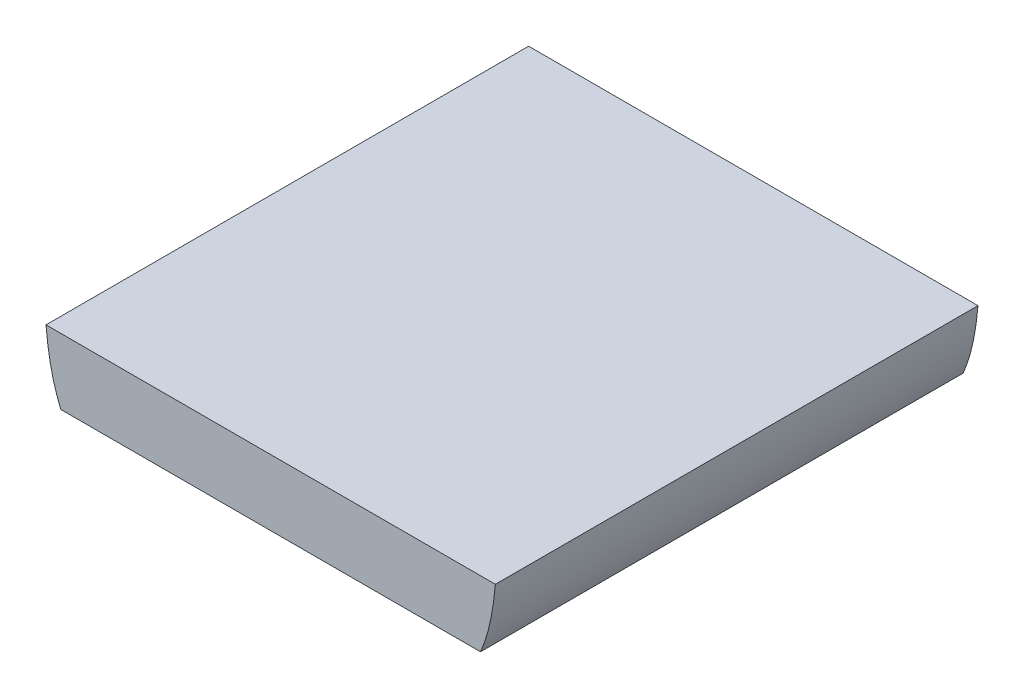
from build123d import *

# Parameters (mm, degrees)
BOSS_EXTRUDE1_DEPTH      = 368.3
BOSS_EXTRUDE1_DEPTH_BACK = 368.3
SPLIT1_SURFACE_1_BACK    = 1031.787
SPLIT1_SURFACE_1_DEPTH   = 2063.574


with BuildPart() as part:
    # Sketch1 → Boss-Extrude1 (new, two sides: drawn at the far end of the back side and taken through both)
    with BuildSketch(Plane.XY.offset(-BOSS_EXTRUDE1_DEPTH_BACK)):
        with BuildLine():
            Line((-342.9, 222.758), (342.9, 222.758))
            add(Edge.make_bspline(
                [(342.9, 222.758), (323.602122165, 0), (0, 0)],
                knots=[0, 0, 0, 1, 1, 1], degree=2, weights=[1, 1.328097491, 1]))
            add(Edge.make_bspline(
                [(-342.9, 222.758), (-323.602122165, 0), (0, 0)],
                knots=[0, 0, 0, 1, 1, 1], degree=2, weights=[1, 1.328097491, 1]))
        make_face()
    extrude(amount=BOSS_EXTRUDE1_DEPTH + BOSS_EXTRUDE1_DEPTH_BACK)

    # Split1: cut with a surface, the side it looks to stays
    # Split1 surface: a surface, the sketch's curves swept straight by 2063.574 mm
    with BuildLine(Plane.XY.offset(-SPLIT1_SURFACE_1_BACK), mode=Mode.PRIVATE) as split1_surface_1_path:
        Line((-363.688822472, 122.174), (403.145628683, 122.174))
    split1_surface_1 = Shell.extrude(split1_surface_1_path.wire(), (0 * SPLIT1_SURFACE_1_DEPTH, 0 * SPLIT1_SURFACE_1_DEPTH, 1 * SPLIT1_SURFACE_1_DEPTH))
    split(bisect_by=split1_surface_1, keep=Keep.TOP)


solid = part.part
